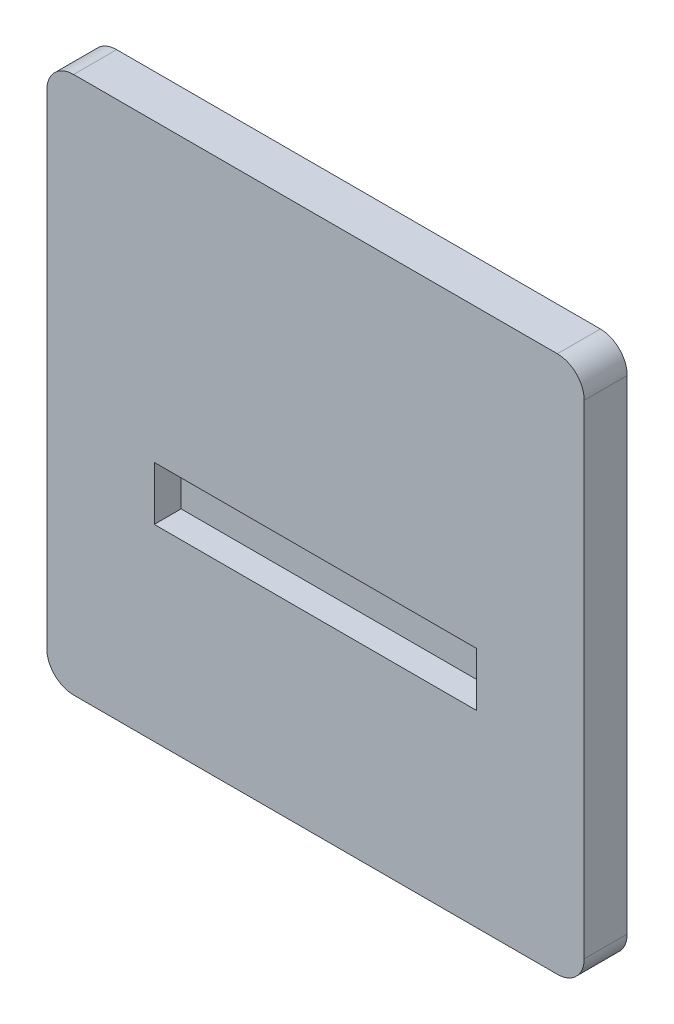
from build123d import *

# Parameters (mm, degrees)
ESQUISSE1_W             = 100
ESQUISSE1_H             = 100
BOSS_EXTRU_1_DEPTH      = 8
ESQUISSE2_W             = 60
ESQUISSE2_H             = 10
ENL_V_MAT_EXTRU_1_DEPTH = 5
CONG_1_R                = 5


with BuildPart() as part:
    # Esquisse1 → Boss.-Extru.1 (new body)
    with BuildSketch(Plane.XY):
        with Locations((50, 50)):
            Rectangle(ESQUISSE1_W, ESQUISSE1_H)
    extrude(amount=BOSS_EXTRU_1_DEPTH)

    # Esquisse2 → Enlèv. mat.-Extru.1 (cut)
    with BuildSketch(Plane.XY.offset(8)):
        with Locations((50, 40)):
            Rectangle(ESQUISSE2_W, ESQUISSE2_H)
    extrude(amount=-ENL_V_MAT_EXTRU_1_DEPTH, mode=Mode.SUBTRACT)

    # Congé1
    cong_1_edges = [part.edges().sort_by_distance(p)[0] for p in [
        (100, 0, 4),
        (0, 0, 4),
        (0, 100, 4),
        (100, 100, 4),
    ]]
    fillet(cong_1_edges, radius=CONG_1_R)


solid = part.part
